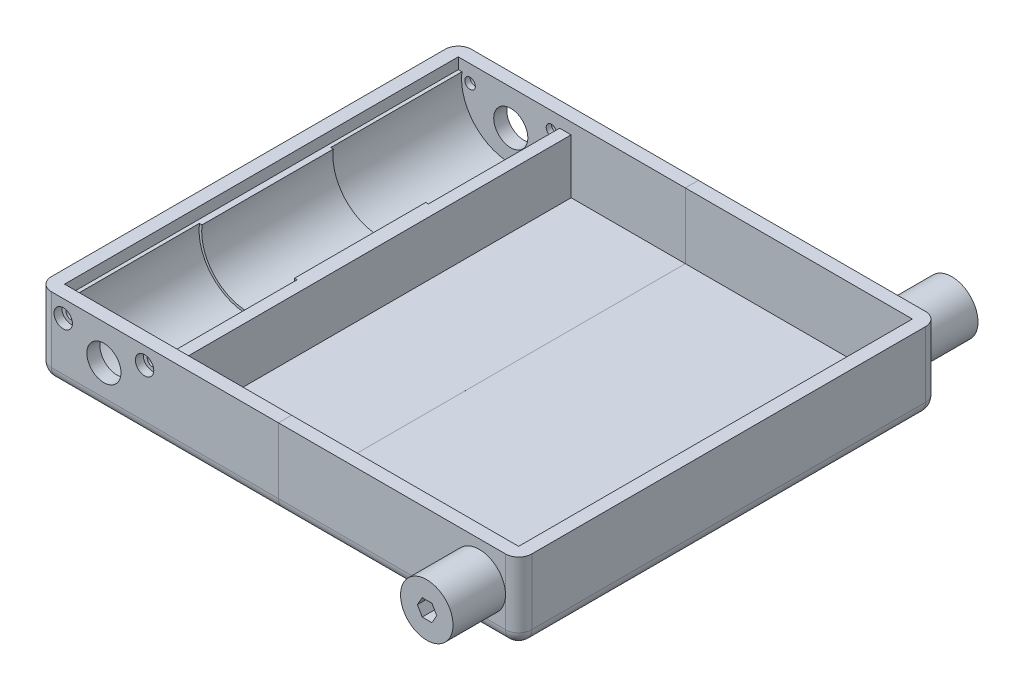
from build123d import *

# Parameters (mm, degrees)
SKETCH5_W                = 183
SKETCH5_H                = 160
BOSS_EXTRUDE3_DEPTH      = 30
SKETCH6_W                = 173
SKETCH6_H                = 150
CUT_EXTRUDE1_DEPTH       = 25
SKETCH7_R                = 6.5
SKETCH7_R_2              = 1
CUT_EXTRUDE2_DEPTH       = 187.741130981
SKETCH11_W               = 43
SKETCH11_H               = 20.759163428
BOSS_EXTRUDE4_DEPTH      = 150
SKETCH8_R                = 18.75
CUT_EXTRUDE4_DEPTH       = 50
SKETCH12_R               = 17.75
CUT_EXTRUDE5_DEPTH       = 100
SKETCH13_R               = 3.5
CUT_EXTRUDE6_DEPTH       = 3
SKETCH14_R               = 2
CUT_EXTRUDE7_DEPTH       = 3
FILLET1_R                = 5
CUT_EXTRUDE8_DEPTH       = 0.0001
CUT_EXTRUDE9_START       = 50
SKETCH16_R               = 18.75
CUT_EXTRUDE9_DEPTH       = 50
SKETCH17_R               = 10
BOSS_EXTRUDE5_DEPTH      = 20
CUT_EXTRUDE10_DEPTH      = 200.742959826
CUT_EXTRUDE10_DEPTH_BACK = 200.742959826
SKETCH18_R               = 1.875
CUT_EXTRUDE11_DEPTH      = 5


# Read off the part's stored shape, not the designer's step: Cut-Extrude8
with BuildPart() as part:
    # Sketch5 → Boss-Extrude3 (new body)
    with BuildSketch(Plane(origin=(0, 0, 0), x_dir=(1, 0, 0), z_dir=(0, 1, 0))):
        Rectangle(SKETCH5_W, SKETCH5_H)
    extrude(amount=BOSS_EXTRUDE3_DEPTH)

    # Sketch6 → Cut-Extrude1 (cut)
    with BuildSketch(Plane(origin=(0, 30, 0), x_dir=(1, 0, 0), z_dir=(0, 1, 0))):
        Rectangle(SKETCH6_W, SKETCH6_H)
    extrude(amount=-CUT_EXTRUDE1_DEPTH, mode=Mode.SUBTRACT)

    # Sketch7 → Cut-Extrude2 (cut, through all)
    with BuildSketch(Plane.XY.offset(80)):
        with Locations((-66.5, 16.5)):
            Circle(SKETCH7_R)
        with Locations((76.5, 16.5)):
            Circle(SKETCH7_R_2)
    extrude(amount=-CUT_EXTRUDE2_DEPTH, mode=Mode.SUBTRACT)

    # Sketch11 → Boss-Extrude4 (add)
    with BuildSketch(Plane(origin=(0, 0, 75), x_dir=(-1, 0, 0), z_dir=(0, 0, -1))):
        with Locations((65, 15.379581714)):
            Rectangle(SKETCH11_W, SKETCH11_H)
    extrude(amount=BOSS_EXTRUDE4_DEPTH)

    # Sketch8 → Cut-Extrude4 (cut)
    with BuildSketch(Plane(origin=(0, 0, 75), x_dir=(-1, 0, 0), z_dir=(0, 0, -1))):
        with Locations((66.5, 23.5)):
            Circle(SKETCH8_R)
    extrude(amount=CUT_EXTRUDE4_DEPTH, mode=Mode.SUBTRACT)

    # Sketch12 → Cut-Extrude5 (cut)
    with BuildSketch(Plane.XY.offset(25)):
        with Locations((-66.5, 23.5)):
            Circle(SKETCH12_R)
    extrude(amount=-CUT_EXTRUDE5_DEPTH, mode=Mode.SUBTRACT)

    # Sketch13 → Cut-Extrude6 (cut)
    with BuildSketch(Plane.XY.offset(80)):
        with Locations((-51, 23.5)):
            Circle(SKETCH13_R)
        with Locations((-82, 23.5)):
            Circle(SKETCH13_R)
    cut_extrude6 = extrude(amount=-CUT_EXTRUDE6_DEPTH, mode=Mode.SUBTRACT)

    # Sketch14 → Cut-Extrude7 (cut)
    with BuildSketch(Plane.XY.offset(77)):
        with Locations((-51, 23.5)):
            Circle(SKETCH14_R)
        with Locations((-82, 23.5)):
            Circle(SKETCH14_R)
    cut_extrude7 = extrude(amount=-CUT_EXTRUDE7_DEPTH, mode=Mode.SUBTRACT)

    # Mirror2: Cut-Extrude6, Cut-Extrude7 across plane
    add(cut_extrude6.mirror(Plane.XY), mode=Mode.SUBTRACT)
    add(cut_extrude7.mirror(Plane.XY), mode=Mode.SUBTRACT)

    # Fillet1
    fillet1_edges = [part.edges().sort_by_distance(p)[0] for p in [
        (0, 0, 80),
        (-91.5, 0, 0),
        (0, 0, -80),
        (91.5, 0, 0),
        (91.5, 15, 80),
        (-91.5, 15, 80),
        (-91.5, 15, -80),
        (91.5, 15, -80),
    ]]
    fillet(fillet1_edges, radius=FILLET1_R)

    # Cut-Extrude8 outline → Cut-Extrude8 (cut)
    with BuildSketch(Plane.YZ):
        with BuildLine():
            Line((5, 75), (30, 75))
            Line((30, 75), (30, 80))
            Line((30, 80), (5, 80))
            ThreePointArc((5, 80), (1.464466094, 78.535533906), (0, 75))
            Line((0, 75), (0, -75))
            ThreePointArc((0, -75), (1.464466094, -78.535533906), (5, -80))
            Line((5, -80), (30, -80))
            Line((30, -80), (30, -75))
            Line((30, -75), (5, -75))
            Line((5, -75), (5, 75))
        make_face()
    extrude(amount=CUT_EXTRUDE8_DEPTH, mode=Mode.SUBTRACT)

    # Sketch16 → Cut-Extrude9 (cut)
    with BuildSketch(Plane.XY.offset(-75).offset(CUT_EXTRUDE9_START)):
        with Locations((-66.5, 23.5)):
            Circle(SKETCH16_R)
    extrude(amount=-CUT_EXTRUDE9_DEPTH, mode=Mode.SUBTRACT)

    # Sketch17 → Boss-Extrude5 (add)
    with BuildSketch(Plane.XY.offset(80)):
        with Locations((76.5, 16.5)):
            Circle(SKETCH17_R)
    boss_extrude5 = extrude(amount=BOSS_EXTRUDE5_DEPTH)

    # Mirror3: Boss-Extrude5 across plane
    add(boss_extrude5.mirror(Plane.XY))

    # Sketch18 → Cut-Extrude10 (cut, two sides: drawn at the far end of the back side and taken through both)
    with BuildSketch(Plane(origin=(0, 0, 75), x_dir=(-1, 0, 0), z_dir=(0, 0, -1)).offset(-CUT_EXTRUDE10_DEPTH_BACK)):
        with Locations((-76.5, 16.5)):
            Circle(SKETCH18_R)
    extrude(amount=CUT_EXTRUDE10_DEPTH + CUT_EXTRUDE10_DEPTH_BACK, mode=Mode.SUBTRACT)

    # Sketch19 → Cut-Extrude11 (cut)
    with BuildSketch(Plane.XY.offset(100)):
        Polygon((80.318153676, 16.502326977), (78.470632815, 19.702326977), (74.775591092, 19.702326977), (72.92807023, 16.502326977), (74.775591092, 13.302326977), (78.470632815, 13.302326977), align=None)
    cut_extrude11 = extrude(amount=-CUT_EXTRUDE11_DEPTH, mode=Mode.SUBTRACT)

    # Mirror4: Cut-Extrude11 across plane
    add(cut_extrude11.mirror(Plane.XY), mode=Mode.SUBTRACT)


solid = part.part
